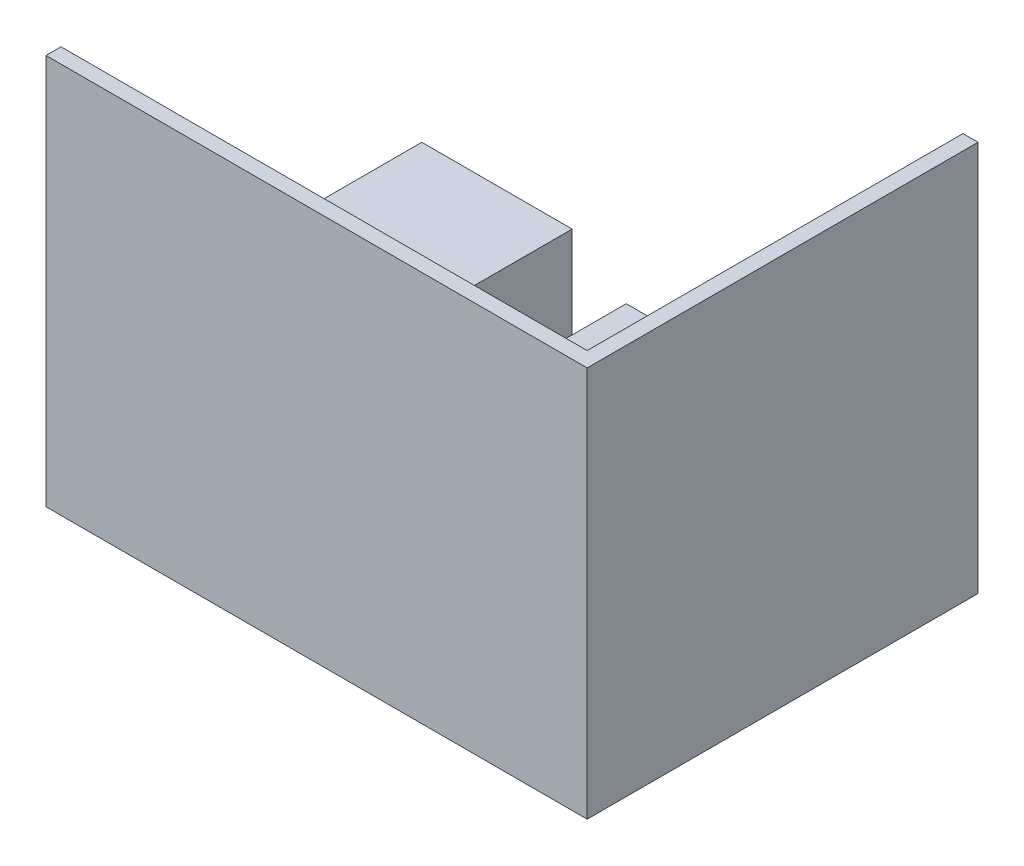
from build123d import *

# Parameters (mm, degrees)
SKETCH1_W           = 3600
SKETCH1_H           = 2600
BOSS_EXTRUDE1_DEPTH = 100
BOSS_EXTRUDE2_DEPTH = 2500
SKETCH4_W           = 1975
SKETCH4_H           = 700
BOSS_EXTRUDE3_DEPTH = 850
SKETCH5_W           = 1000
SKETCH5_H           = 2500
BOSS_EXTRUDE4_DEPTH = 750
SKETCH6_W           = 700
SKETCH6_H           = 500
BOSS_EXTRUDE5_DEPTH = 750
SKETCH7_W           = 700
SKETCH7_H           = 500
BOSS_EXTRUDE6_DEPTH = 750


with BuildPart() as part:
    # Sketch1 → Boss-Extrude1 (new body)
    with BuildSketch(Plane(origin=(0, 0, 0), x_dir=(1, 0, 0), z_dir=(0, 1, 0))):
        with Locations((1800, 1300)):
            Rectangle(SKETCH1_W, SKETCH1_H)
    extrude(amount=BOSS_EXTRUDE1_DEPTH)

    # Sketch2 → Boss-Extrude2 (add)
    with BuildSketch(Plane(origin=(0, 100, 0), x_dir=(1, 0, 0), z_dir=(0, 1, 0))):
        Polygon((3600, 2600), (3600, 0), (0, 0), (0, 100), (3500, 100), (3500, 2600), align=None)
    extrude(amount=BOSS_EXTRUDE2_DEPTH)

    # Sketch4 → Boss-Extrude3 (add)
    with BuildSketch(Plane(origin=(0, 100, 0), x_dir=(1, 0, 0), z_dir=(0, 1, 0))):
        with Locations((2497.5, 1350)):
            Rectangle(SKETCH4_W, SKETCH4_H)
    extrude(amount=BOSS_EXTRUDE3_DEPTH)

    # Sketch5 → Boss-Extrude4 (add)
    with BuildSketch(Plane(origin=(0, 100, 0), x_dir=(1, 0, 0), z_dir=(0, 1, 0))):
        with Locations((500, 1250)):
            Rectangle(SKETCH5_W, SKETCH5_H)
    extrude(amount=BOSS_EXTRUDE4_DEPTH)

    # Sketch6 → Boss-Extrude5 (add)
    with BuildSketch(Plane(origin=(0, 100, 0), x_dir=(1, 0, 0), z_dir=(0, 1, 0))):
        with Locations((1960, 2000)):
            Rectangle(SKETCH6_W, SKETCH6_H)
    extrude(amount=BOSS_EXTRUDE5_DEPTH)

    # Sketch7 → Boss-Extrude6 (add)
    with BuildSketch(Plane(origin=(0, 100, 0), x_dir=(1, 0, 0), z_dir=(0, 1, 0))):
        with Locations((1960, 700)):
            Rectangle(SKETCH7_W, SKETCH7_H)
    extrude(amount=BOSS_EXTRUDE6_DEPTH)


solid = part.part
